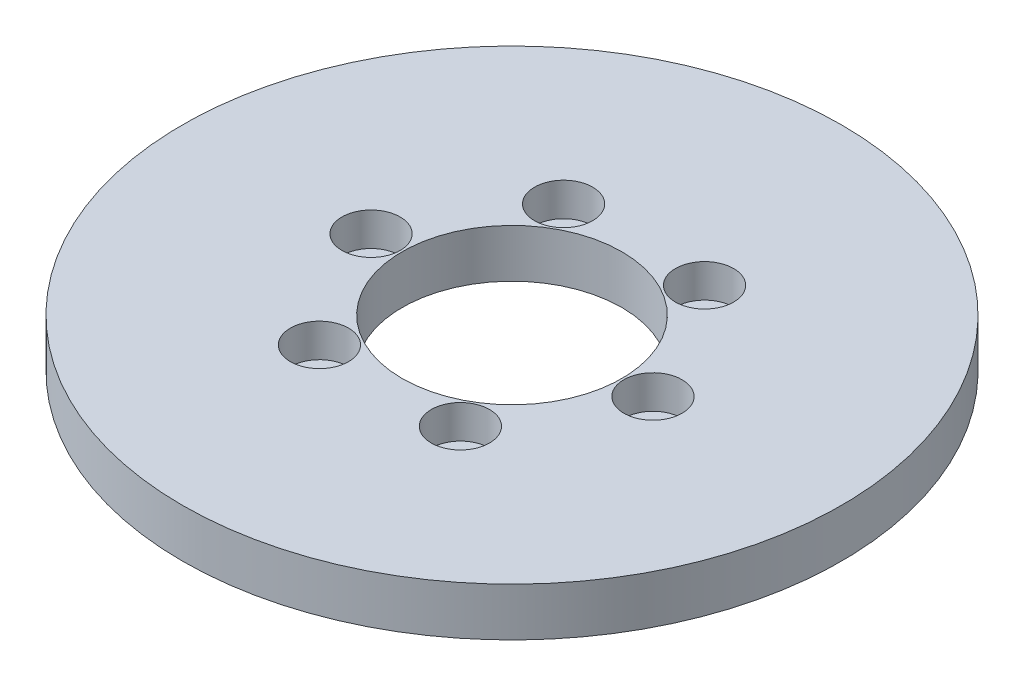
from build123d import *

# Parameters (mm, degrees)
SKETCH1_R           = 75
BOSS_EXTRUDE1_DEPTH = 11
SKETCH2_R           = 25
CUT_EXTRUDE1_DEPTH  = 107.6348911
SKETCH3_R           = 6.621835616
CUT_EXTRUDE2_DEPTH  = 7.602484305
CIRPATTERN1_COUNT   = 6


with BuildPart() as part:
    # Sketch1 → Boss-Extrude1 (new body)
    with BuildSketch(Plane(origin=(0, 0, 0), x_dir=(1, 0, 0), z_dir=(0, 1, 0))):
        Circle(SKETCH1_R)
    extrude(amount=BOSS_EXTRUDE1_DEPTH)

    # Sketch2 → Cut-Extrude1 (cut, through all)
    with BuildSketch(Plane(origin=(0, 0, 0), x_dir=(1, 0, 0), z_dir=(0, 1, 0))):
        Circle(SKETCH2_R)
    extrude(amount=CUT_EXTRUDE1_DEPTH, mode=Mode.SUBTRACT)

    # Sketch3 → Cut-Extrude2 (cut)
    with BuildSketch(Plane(origin=(0, 11, 0), x_dir=(1, 0, 0), z_dir=(0, 1, 0))):
        with Locations((-32.077977474, 0)):
            Circle(SKETCH3_R)
    cut_extrude2 = extrude(amount=-CUT_EXTRUDE2_DEPTH, mode=Mode.SUBTRACT)

    # CirPattern1: Cut-Extrude2 ×6 about axis
    cirpattern1_axis = Axis((0, 0, 0), (0, 1, 0))
    for i in range(1, CIRPATTERN1_COUNT):
        add(cut_extrude2.rotate(cirpattern1_axis, i * 360 / CIRPATTERN1_COUNT), mode=Mode.SUBTRACT)


solid = part.part
